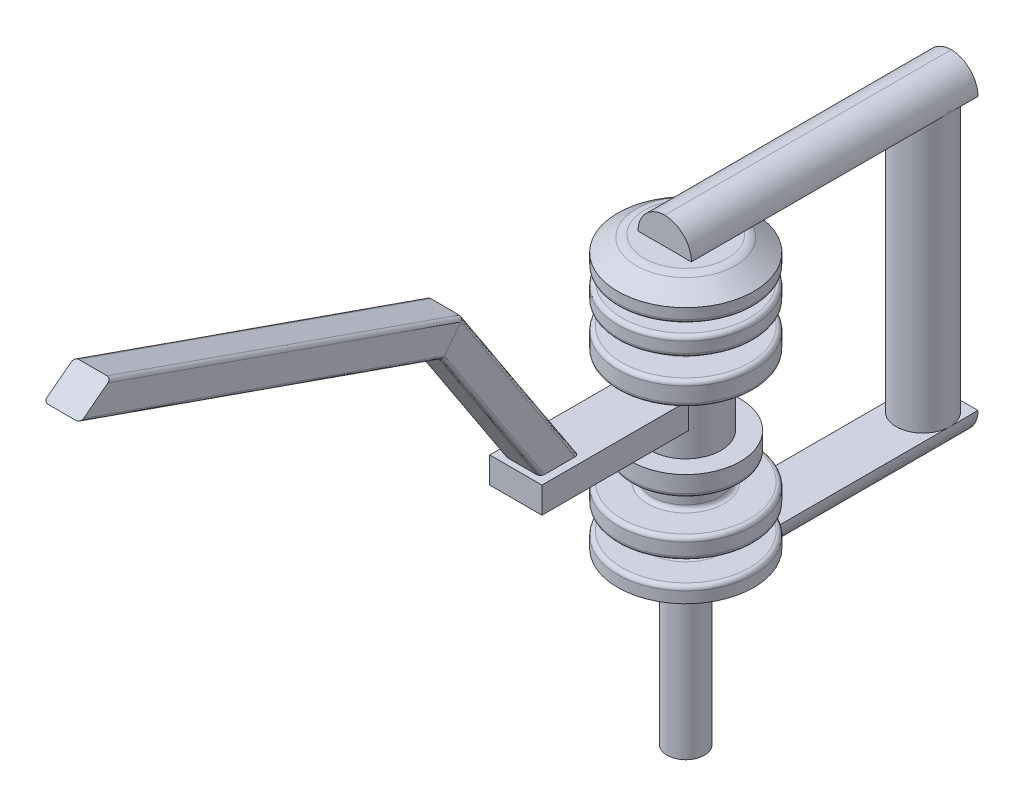
from build123d import *

# Parameters (mm, degrees)
CROQUIS3_W              = 39.25860833
CROQUIS3_H              = 210.778215778
SALIENTE_EXTRUIR1_DEPTH = 20
REDONDEO1_R             = 20
CROQUIS4_W              = 39.25860833
CROQUIS4_H              = 195.29619761
SALIENTE_EXTRUIR2_DEPTH = 20
REDONDEO2_R             = 20
CROQUIS5_R              = 19.629304165
SALIENTE_EXTRUIR3_DEPTH = 201
CROQUIS6_W              = 38.423934492
CROQUIS6_H              = 19.211967246
SALIENTE_EXTRUIR4_DEPTH = 125
CROQUIS8_R              = 13.7
SALIENTE_EXTRUIR5_DEPTH = 125


with BuildPart() as part:
    # Croquis2 → Revolución2 (revolve)
    with BuildSketch(Plane.XY, mode=Mode.PRIVATE) as revoluci_n2_sk:
        with BuildLine():
            Line((0, 0), (50, 0))
            Line((50, 0), (50, 8.179463204))
            ThreePointArc((50, 8.179463204), (49.121320344, 10.300783548), (47, 11.179463204))
            Line((47, 11.179463204), (28, 11.179463204))
            ThreePointArc((28, 11.179463204), (25.878679656, 12.058142861), (25, 14.179463204))
            Line((25, 14.179463204), (25, 24.19601925))
            ThreePointArc((25, 24.19601925), (25.878679656, 26.317339593), (28, 27.19601925))
            Line((28, 27.19601925), (47, 27.19601925))
            ThreePointArc((47, 27.19601925), (49.121320344, 28.074698906), (50, 30.19601925))
            Line((50, 30.19601925), (50, 39.322766626))
            ThreePointArc((50, 39.322766626), (49.121320344, 41.44408697), (47, 42.322766626))
            Line((47, 42.322766626), (28, 42.322766626))
            ThreePointArc((28, 42.322766626), (25.878679656, 43.201446283), (25, 45.322766626))
            Line((25, 45.322766626), (25, 57.118940011))
            ThreePointArc((25, 57.118940011), (25.878679656, 59.240260354), (28, 60.118940011))
            Line((28, 60.118940011), (37, 60.118940011))
            ThreePointArc((37, 60.118940011), (39.121320344, 60.997619667), (40, 63.118940011))
            Line((40, 63.118940011), (40, 75.245687387))
            Line((40, 75.245687387), (25.878679656, 75.245687387))
            Line((25.878679656, 75.245687387), (25.878679656, 124.719122396))
            Line((25.878679656, 124.719122396), (47, 124.719122396))
            ThreePointArc((47, 124.719122396), (49.121320344, 125.597802053), (50, 127.719122396))
            Line((50, 127.719122396), (50, 138.740755007))
            ThreePointArc((50, 138.740755007), (49.121320344, 140.862075351), (47, 141.740755007))
            Line((47, 141.740755007), (28, 141.740755007))
            ThreePointArc((28, 141.740755007), (25.878679656, 142.619434663), (25, 144.740755007))
            Line((25, 144.740755007), (25, 153.492836603))
            ThreePointArc((25, 153.492836603), (25.878679656, 155.614156947), (28, 156.492836603))
            Line((28, 156.492836603), (47, 156.492836603))
            ThreePointArc((47, 156.492836603), (49.121320344, 157.371516259), (50, 159.492836603))
            Line((50, 159.492836603), (50, 167.255239291))
            ThreePointArc((50, 167.255239291), (49.121320344, 169.376559635), (47, 170.255239291))
            Line((47, 170.255239291), (28, 170.255239291))
            ThreePointArc((28, 170.255239291), (25.878679656, 171.133918947), (25, 173.255239291))
            Line((25, 173.255239291), (25, 175.053571243))
            ThreePointArc((25, 175.053571243), (25.878679656, 177.174891587), (28, 178.053571243))
            Line((28, 178.053571243), (47, 178.053571243))
            ThreePointArc((47, 178.053571243), (49.121320344, 178.9322509), (50, 181.053571243))
            Line((50, 181.053571243), (50, 188.610357417))
            Line((50, 188.610357417), (36.370731762, 198.183186285))
            ThreePointArc((36.370731762, 198.183186285), (33.637062214, 199.534984605), (30.623083353, 200))
            Line((30.623083353, 200), (0, 200))
            Line((0, 200), (0, 0))
        make_face()
    revolve(revoluci_n2_sk.sketch.rotate(Axis((0, 0, 0), (0, 1, 0)), 90), axis=Axis((0, 0, 0), (0, 1, 0)))

    # Croquis3 → Saliente-Extruir1 (add)
    with BuildSketch(Plane(origin=(0, 200, 0), x_dir=(1, 0, 0), z_dir=(0, 1, 0))):
        with Locations((0, 89.907089721)):
            Rectangle(CROQUIS3_W, CROQUIS3_H)
    extrude(amount=SALIENTE_EXTRUIR1_DEPTH)

    # Redondeo1
    # the kernel refuses this fillet: 20 mm, written as the material it takes off along each edge
    with BuildSketch(Plane(origin=(-19.629304165, 220, -245.29619761), x_dir=(0, -1, 0), z_dir=(0, 0, 1)), Plane(origin=(19.629304165, 220, 65.482018168), x_dir=(0, -1, 0), z_dir=(0, 0, -1))) as redondeo1_piece_1:
        with BuildLine():
            CenterArc((REDONDEO1_R, REDONDEO1_R), REDONDEO1_R, 180, 90)
            Line((0, REDONDEO1_R), (0, 0))
            Line((0, 0), (REDONDEO1_R, 0))
        make_face()
    extrude(amount=310.778215777, mode=Mode.SUBTRACT)

    # Croquis4 → Saliente-Extruir2 (add)
    with BuildSketch(Plane.XZ):
        with Locations((0, -97.648098805)):
            Rectangle(CROQUIS4_W, CROQUIS4_H)
    extrude(amount=SALIENTE_EXTRUIR2_DEPTH)

    # Redondeo2
    # the kernel refuses this fillet: 20 mm, written as the material it takes off along each edge
    with BuildSketch(Plane(origin=(-19.629304165, -20, 50), x_dir=(0, 1, 0), z_dir=(0, 0, -1)), Plane(origin=(19.629304165, -20, -245.29619761), x_dir=(0, 1, 0), z_dir=(0, 0, 1))) as redondeo2_piece_1:
        with BuildLine():
            CenterArc((REDONDEO2_R, REDONDEO2_R), REDONDEO2_R, 180, 90)
            Line((0, REDONDEO2_R), (0, 0))
            Line((0, 0), (REDONDEO2_R, 0))
        make_face()
    extrude(amount=295.29619761, mode=Mode.SUBTRACT)

    # Croquis5 → Saliente-Extruir3 (add)
    with BuildSketch(Plane(origin=(0, 0, 0), x_dir=(1, 0, 0), z_dir=(0, 1, 0))):
        with Locations(Location((0, 174.471282207, 0), (0, 0, 180))):
            Circle(CROQUIS5_R)
    extrude(amount=SALIENTE_EXTRUIR3_DEPTH)

    # Croquis6 → Saliente-Extruir4 (add)
    with BuildSketch(Plane.XY):
        with Locations((0, 102.78067947)):
            Rectangle(CROQUIS6_W, CROQUIS6_H)
    extrude(amount=SALIENTE_EXTRUIR4_DEPTH)

    # Barrer1: sweep along a curve in space
    with BuildLine() as barrer1_path:
        Line((0, 112.386663093, 106.072040946), (0, 232.48937605, 184.842954986))
        Line((0, 232.48937605, 184.842954986), (0, 324.491177071, 447.359138572))
    # Croquis7 → Barrer1 (sweep)
    with BuildSketch(Plane(origin=(0, 112.386663093, 0), x_dir=(1, 0, 0), z_dir=(0, 1, 0))):
        with BuildLine():
            Line((10.438402565, -91.848136446), (-10.438402565, -91.848136446))
            ThreePointArc((-10.438402565, -91.848136446), (-12.559722908, -92.726816103), (-13.438402565, -94.848136446))
            Line((-13.438402565, -94.848136446), (-13.438402565, -117.295945446))
            ThreePointArc((-13.438402565, -117.295945446), (-12.559722908, -119.41726579), (-10.438402565, -120.295945446))
            Line((-10.438402565, -120.295945446), (10.438402565, -120.295945446))
            ThreePointArc((10.438402565, -120.295945446), (12.559722908, -119.41726579), (13.438402565, -117.295945446))
            Line((13.438402565, -117.295945446), (13.438402565, -94.848136446))
            ThreePointArc((13.438402565, -94.848136446), (12.559722908, -92.726816103), (10.438402565, -91.848136446))
        make_face()
    sweep(path=barrer1_path.line, transition=Transition.RIGHT)

    # Croquis8 → Saliente-Extruir5 (add)
    with BuildSketch(Plane.XZ):
        with Locations(Location((0, 0, 0), (0, 0, 270))):
            Circle(CROQUIS8_R)
    extrude(amount=SALIENTE_EXTRUIR5_DEPTH)


solid = part.part
